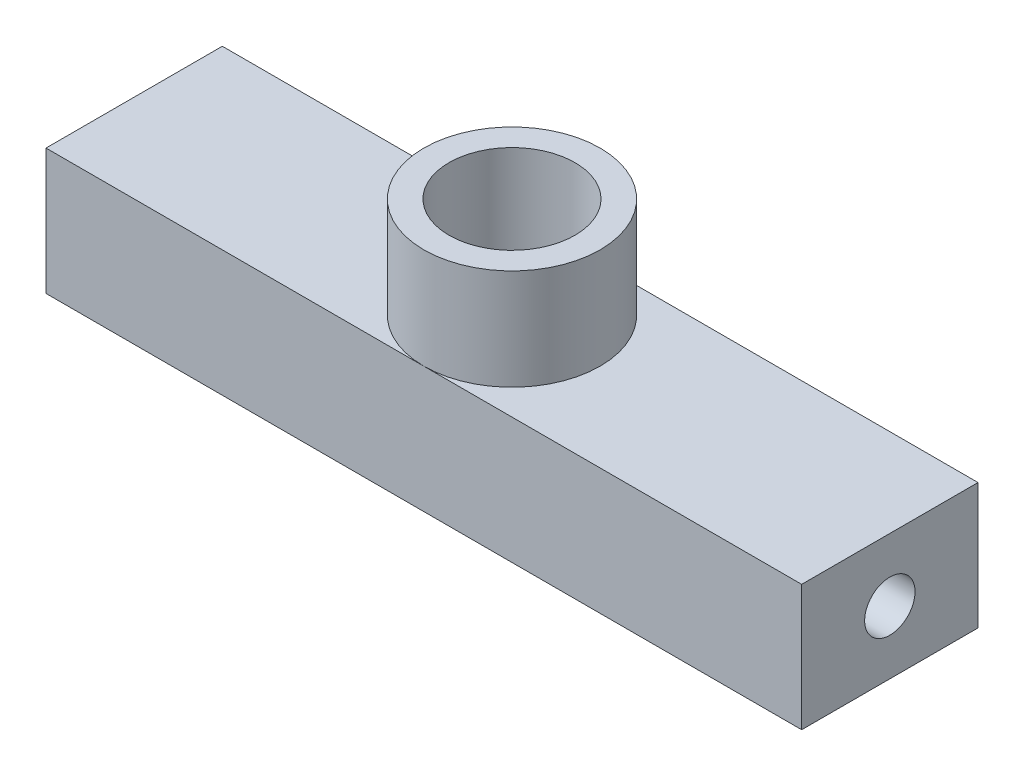
from build123d import *

# Parameters (mm, degrees)
SKETCH1_W           = 30
SKETCH1_H           = 7
BOSS_EXTRUDE1_DEPTH = 5
SKETCH2_R           = 3.5
SKETCH2_R_2         = 2.5
BOSS_EXTRUDE2_DEPTH = 4
SKETCH3_R           = 1.75
CUT_EXTRUDE1_DEPTH  = 18.839562775
SKETCH4_R           = 2.5
CUT_EXTRUDE3_DEPTH  = 4
SKETCH5_R           = 1
CUT_EXTRUDE4_DEPTH  = 10
CUT_EXTRUDE5_START  = -10
SKETCH6_R           = 1
CUT_EXTRUDE5_DEPTH  = 10


with BuildPart() as part:
    # Sketch1 → Boss-Extrude1 (new body)
    with BuildSketch(Plane(origin=(0, 0, 0), x_dir=(1, 0, 0), z_dir=(0, 1, 0))):
        Rectangle(SKETCH1_W, SKETCH1_H)
    extrude(amount=BOSS_EXTRUDE1_DEPTH)

    # Sketch2 → Boss-Extrude2 (add)
    with BuildSketch(Plane(origin=(0, 5, 0), x_dir=(1, 0, 0), z_dir=(0, 1, 0))):
        Circle(SKETCH2_R)
        Circle(SKETCH2_R_2, mode=Mode.SUBTRACT)
    extrude(amount=BOSS_EXTRUDE2_DEPTH)

    # Sketch3 → Cut-Extrude1 (cut, through all)
    with BuildSketch(Plane.XZ):
        Circle(SKETCH3_R)
    extrude(amount=-CUT_EXTRUDE1_DEPTH, mode=Mode.SUBTRACT)

    # Sketch4 → Cut-Extrude3 (cut)
    with BuildSketch(Plane(origin=(0, 0, 0), x_dir=(-1, 0, 0), z_dir=(0, -1, 0))):
        Circle(SKETCH4_R)
    extrude(amount=-CUT_EXTRUDE3_DEPTH, mode=Mode.SUBTRACT)

    # Sketch5 → Cut-Extrude4 (cut)
    with BuildSketch(Plane(origin=(15, 0, 0), x_dir=(0, 0, -1), z_dir=(1, 0, 0))):
        with Locations((0, 2.5)):
            Circle(SKETCH5_R)
    extrude(amount=-CUT_EXTRUDE4_DEPTH, mode=Mode.SUBTRACT)

    # Sketch6 → Cut-Extrude5 (cut)
    with BuildSketch(Plane.ZY.offset(15).offset(CUT_EXTRUDE5_START)):
        with Locations((0, 2.5)):
            Circle(SKETCH6_R)
    extrude(amount=CUT_EXTRUDE5_DEPTH, mode=Mode.SUBTRACT)


solid = part.part
